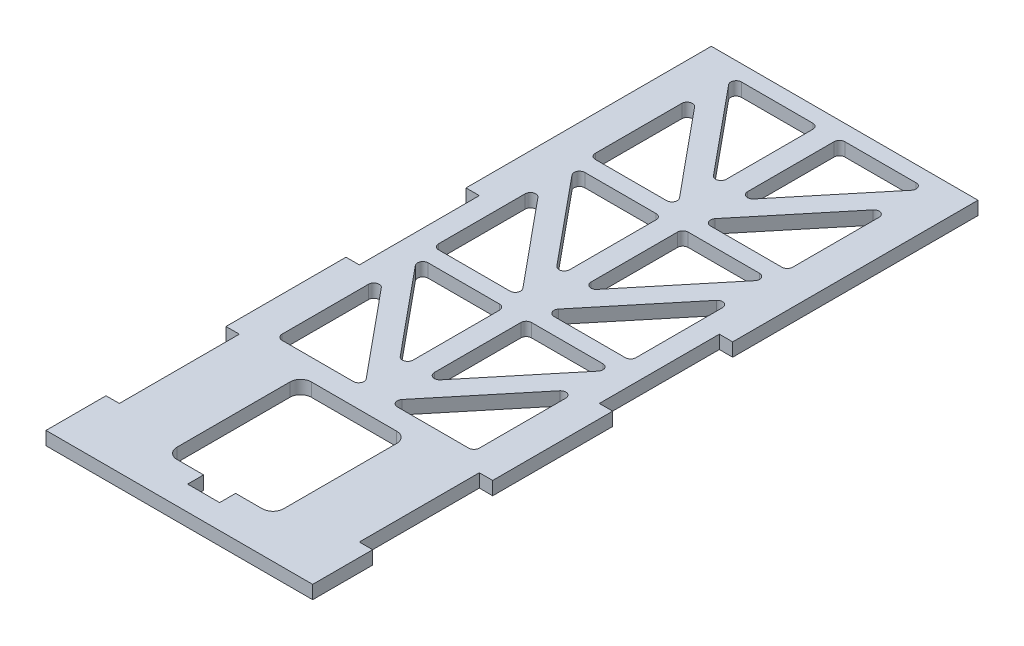
from build123d import *

# Parameters (mm, degrees)
BOSS_EXTRUDE1_DEPTH    = 3.175
CUT_EXTRUDE1_DEPTH     = 233.372048712
FILLET1_R              = 1.27
LPATTERN1_COUNT        = 3
LPATTERN1_PITCH        = 37.3
FILLET1_OF_LPATTERN1_R = 1.27
MIRROR1_START          = -9.743731804
MIRROR1_DEPTH          = 3.175


# Read off the part's stored shape, not the designer's step: Mirror1
with BuildPart() as part:
    # Sketch1 → Boss-Extrude1 (new body)
    with BuildSketch(Plane(origin=(0, -9.743731804, 0), x_dir=(1, 0, 0), z_dir=(0, 1, 0))):
        Polygon((-31.75, 143.175862399), (-28.575, 143.175862399), (-28.575, 171.750862399), (-31.75, 171.750862399), (-31.75, 230.170862399), (31.75, 230.170862399), (31.75, 171.750862399), (28.575, 171.750862399), (28.575, 143.175862399), (31.75, 143.175862399), (31.75, 114.600862399), (28.575, 114.600862399), (28.575, 86.025862399), (31.75, 86.025862399), (31.75, 71.738362399), (-31.75, 71.738362399), (-31.75, 86.025862399), (-28.575, 86.025862399), (-28.575, 114.600862399), (-31.75, 114.600862399), align=None)
        with BuildLine():
            Line((-10.16, 113.330862399), (10.16, 113.330862399))
            ThreePointArc((10.16, 113.330862399), (11.956051224, 112.586913623), (12.7, 110.790862399))
            Line((12.7, 110.790862399), (12.7, 83.870862391))
            ThreePointArc((12.7, 83.870862391), (11.956051224, 82.074811167), (10.16, 81.330862391))
            Line((10.16, 81.330862391), (3.81, 81.330862391))
            Line((3.81, 81.330862391), (3.81, 77.520862391))
            Line((3.81, 77.520862391), (-3.81, 77.520862391))
            Line((-3.81, 77.520862391), (-3.81, 81.330862391))
            Line((-3.81, 81.330862391), (-10.16, 81.330862391))
            ThreePointArc((-10.16, 81.330862391), (-11.956051224, 82.074811167), (-12.7, 83.870862391))
            Line((-12.7, 83.870862391), (-12.7, 110.790862399))
            ThreePointArc((-12.7, 110.790862399), (-11.956051224, 112.586913623), (-10.16, 113.330862399))
        make_face(mode=Mode.SUBTRACT)
    extrude(amount=BOSS_EXTRUDE1_DEPTH)

    # Sketch2 → Cut-Extrude1 (cut, through all)
    with BuildSketch(Plane(origin=(0, -6.568731804, 0), x_dir=(1, 0, 0), z_dir=(0, 1, 0))):
        Polygon((-23.495, 143.810862399), (-23.495, 118.410862399), (-2.54, 118.410862399), align=None)
        Polygon((-23.495, 151.793477209), (-2.54, 126.393477209), (-2.54, 151.793477209), align=None)
    cut_extrude1 = extrude(amount=-CUT_EXTRUDE1_DEPTH, mode=Mode.SUBTRACT)

    # Fillet1
    fillet1_edges = [part.edges().sort_by_distance(p)[0] for p in [
        (-23.495, -8.156231804, -151.793477209),
        (-2.54, -8.156231804, -151.793477209),
        (-2.54, -8.156231804, -126.393477209),
        (-23.495, -8.156231804, -143.810862399),
        (-2.54, -8.156231804, -118.410862399),
        (-23.495, -8.156231804, -118.410862399),
    ]]
    fillet(fillet1_edges, radius=FILLET1_R)

    # LPattern1: Cut-Extrude1 ×3
    with Locations(*[(0, 0, -i * LPATTERN1_PITCH) for i in range(1, LPATTERN1_COUNT)]):
        add(cut_extrude1, mode=Mode.SUBTRACT)

    # Fillet1 of LPattern1
    fillet1_of_lpattern1_edges = [part.edges().sort_by_distance(p)[0] for p in [
        (-23.495, -8.156231804, -189.093477209),
        (-2.54, -8.156231804, -189.093477209),
        (-2.54, -8.156231804, -163.693477209),
        (-23.495, -8.156231804, -181.110862399),
        (-2.54, -8.156231804, -155.710862399),
        (-23.495, -8.156231804, -155.710862399),
        (-23.495, -8.156231804, -226.393477209),
        (-2.54, -8.156231804, -226.393477209),
        (-2.54, -8.156231804, -200.993477209),
        (-23.495, -8.156231804, -218.410862399),
        (-2.54, -8.156231804, -193.010862399),
        (-23.495, -8.156231804, -193.010862399),
    ]]
    fillet(fillet1_of_lpattern1_edges, radius=FILLET1_OF_LPATTERN1_R)

    # Mirror1 outline → Mirror1 (cut)
    with BuildSketch(Plane(origin=(0, 0, 0), x_dir=(1, 0, 0), z_dir=(0, 1, 0)).offset(MIRROR1_START)):
        with BuildLine():
            Line((20.800835695, 226.393477209), (3.81, 226.393477209))
            ThreePointArc((3.81, 226.393477209), (2.911974388, 226.021502821), (2.54, 225.123477209))
            Line((2.54, 225.123477209), (2.54, 204.528524851))
            ThreePointArc((2.54, 204.528524851), (3.380609712, 203.333316091), (4.789644064, 203.720318499))
            Line((4.789644064, 203.720318499), (21.780479759, 224.315270857))
            ThreePointArc((21.780479759, 224.315270857), (21.949600699, 225.664992644), (20.800835695, 226.393477209))
        make_face()
        with BuildLine():
            Line((5.234164305, 193.010862399), (22.225, 193.010862399))
            ThreePointArc((22.225, 193.010862399), (23.123025612, 193.382836787), (23.495, 194.280862399))
            Line((23.495, 194.280862399), (23.495, 214.875814757))
            ThreePointArc((23.495, 214.875814757), (22.654390288, 216.071023517), (21.245355936, 215.68402111))
            Line((21.245355936, 215.68402111), (4.254520241, 195.089068752))
            ThreePointArc((4.254520241, 195.089068752), (4.085399301, 193.739346964), (5.234164305, 193.010862399))
        make_face()
        with BuildLine():
            Line((5.234164305, 118.410862399), (22.225, 118.410862399))
            ThreePointArc((22.225, 118.410862399), (23.123025612, 118.782836787), (23.495, 119.680862399))
            Line((23.495, 119.680862399), (23.495, 140.275814757))
            ThreePointArc((23.495, 140.275814757), (22.654390288, 141.471023517), (21.245355936, 141.08402111))
            Line((21.245355936, 141.08402111), (4.254520241, 120.489068752))
            ThreePointArc((4.254520241, 120.489068752), (4.085399301, 119.139346964), (5.234164305, 118.410862399))
        make_face()
        with BuildLine():
            Line((20.800835695, 151.793477209), (3.81, 151.793477209))
            ThreePointArc((3.81, 151.793477209), (2.911974388, 151.421502821), (2.54, 150.523477209))
            Line((2.54, 150.523477209), (2.54, 129.928524851))
            ThreePointArc((2.54, 129.928524851), (3.380609712, 128.733316091), (4.789644064, 129.120318499))
            Line((4.789644064, 129.120318499), (21.780479759, 149.715270857))
            ThreePointArc((21.780479759, 149.715270857), (21.949600699, 151.064992644), (20.800835695, 151.793477209))
        make_face()
        with BuildLine():
            Line((5.234164305, 155.710862399), (22.225, 155.710862399))
            ThreePointArc((22.225, 155.710862399), (23.123025612, 156.082836787), (23.495, 156.980862399))
            Line((23.495, 156.980862399), (23.495, 177.575814757))
            ThreePointArc((23.495, 177.575814757), (22.654390288, 178.771023517), (21.245355936, 178.38402111))
            Line((21.245355936, 178.38402111), (4.254520241, 157.789068752))
            ThreePointArc((4.254520241, 157.789068752), (4.085399301, 156.439346964), (5.234164305, 155.710862399))
        make_face()
        with BuildLine():
            Line((20.800835695, 189.093477209), (3.81, 189.093477209))
            ThreePointArc((3.81, 189.093477209), (2.911974388, 188.721502821), (2.54, 187.823477209))
            Line((2.54, 187.823477209), (2.54, 167.228524851))
            ThreePointArc((2.54, 167.228524851), (3.380609712, 166.033316091), (4.789644064, 166.420318499))
            Line((4.789644064, 166.420318499), (21.780479759, 187.015270857))
            ThreePointArc((21.780479759, 187.015270857), (21.949600699, 188.364992644), (20.800835695, 189.093477209))
        make_face()
    extrude(amount=MIRROR1_DEPTH, mode=Mode.SUBTRACT)


solid = part.part
